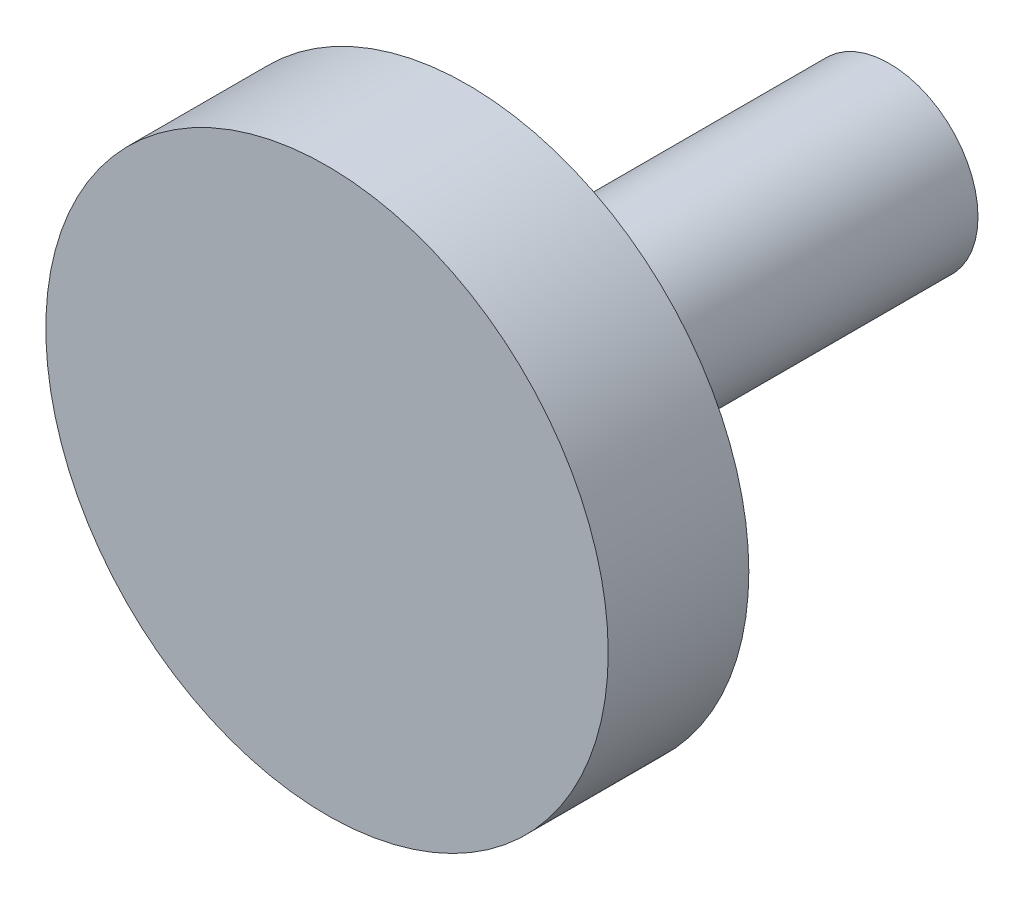
from build123d import *

# Parameters (mm, degrees)
SKETCH1_R           = 12.7
BOSS_EXTRUDE1_DEPTH = 6.35
SKETCH2_R           = 4
BOSS_EXTRUDE2_DEPTH = 19.05


with BuildPart() as part:
    # Sketch1 → Boss-Extrude1 (new body)
    with BuildSketch(Plane.XY):
        Circle(SKETCH1_R)
    extrude(amount=BOSS_EXTRUDE1_DEPTH)

    # Sketch2 → Boss-Extrude2 (add)
    with BuildSketch(Plane.XY):
        Circle(SKETCH2_R)
    extrude(amount=-BOSS_EXTRUDE2_DEPTH)


solid = part.part
